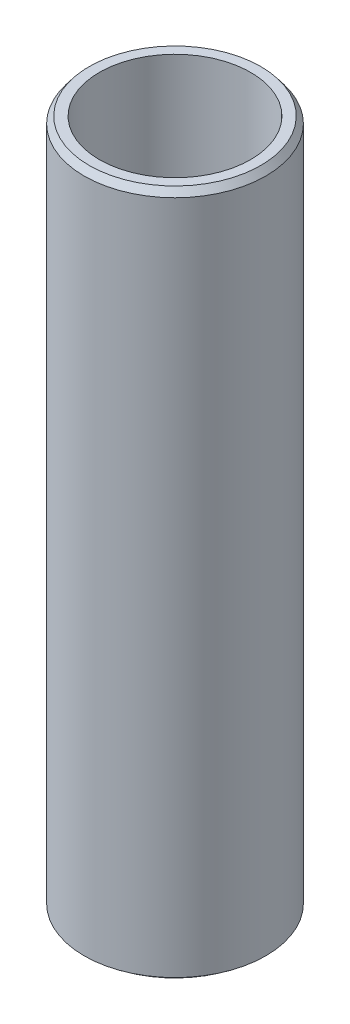
from build123d import *
from OCP.BRepFilletAPI import BRepFilletAPI_MakeChamfer

# Parameters (mm, degrees)
SKETCH1_R           = 35
BOSS_EXTRUDE1_DEPTH = 264.823582539
SKETCH2_R           = 29.158947345
CUT_EXTRUDE1_DEPTH  = 270.409594983
CHAMFER1_SIZE       = 2.553884775
CHAMFER1_SIZE2      = 1.942132805


with BuildPart() as part:
    # Sketch1 → Boss-Extrude1 (new body)
    with BuildSketch(Plane(origin=(0, 0, 0), x_dir=(1, 0, 0), z_dir=(0, 1, 0))):
        Circle(SKETCH1_R)
    extrude(amount=BOSS_EXTRUDE1_DEPTH)

    # Sketch2 → Cut-Extrude1 (cut, through all)
    with BuildSketch(Plane(origin=(0, 0, 0), x_dir=(1, 0, 0), z_dir=(0, 1, 0))):
        Circle(SKETCH2_R)
    extrude(amount=CUT_EXTRUDE1_DEPTH, mode=Mode.SUBTRACT)

    # Chamfer1: one chamfer whose edges measure the first distance from different faces: ONE call of the kernel's chamfer builder (chamfer() names one face for all edges)
    chamfer1_edges_1 = [part.edges().sort_by_distance(p)[0] for p in [
        (-35, 264.823582539, 0),
    ]]
    chamfer1_side_1 = [part.faces().sort_by_distance(p)[0] for p in [
        (-35, 132.411791269, 0),
    ]]
    chamfer1_edges_2 = [part.edges().sort_by_distance(p)[0] for p in [
        (-35, 0, 0),
    ]]
    chamfer1_side_2 = [part.faces().sort_by_distance(p)[0] for p in [
        (-34.010050506, 0, 0),
    ]]
    chamfer1 = BRepFilletAPI_MakeChamfer(part.part.solid().wrapped)
    for e in chamfer1_edges_1:
        chamfer1.Add(CHAMFER1_SIZE, CHAMFER1_SIZE2, e.wrapped, chamfer1_side_1[0].wrapped)  # the first distance lies on this face
    for e in chamfer1_edges_2:
        chamfer1.Add(CHAMFER1_SIZE, CHAMFER1_SIZE2, e.wrapped, chamfer1_side_2[0].wrapped)  # the first distance lies on this face
    add(Compound.cast(chamfer1.Shape()), mode=Mode.REPLACE)


solid = part.part
